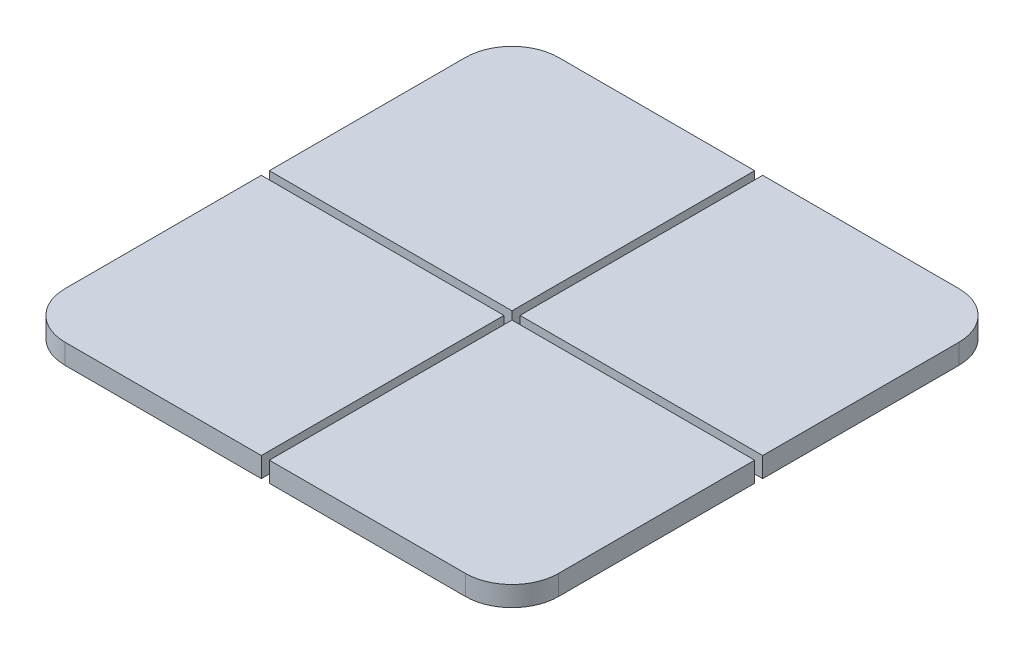
from build123d import *

# Parameters (mm, degrees)
BOSS_EXTRUDE1_DEPTH   = 1.27
BOSS_EXTRUDE1_2_DEPTH = 1.27
BOSS_EXTRUDE1_3_DEPTH = 1.27
BOSS_EXTRUDE1_4_DEPTH = 1.27


with BuildPart() as part:
    # Sketch1 → Boss-Extrude1 (new body)
    with BuildSketch(Plane(origin=(0, 0, 0), x_dir=(1, 0, 0), z_dir=(0, 1, 0))):
        with BuildLine():
            Line((-0.254, 15.621), (-12.6746, 15.621))
            ThreePointArc((-12.6746, 15.621), (-14.75801942, 14.75801942), (-15.621, 12.6746))
            Line((-15.621, 12.6746), (-15.621, 0.254))
            Line((-15.621, 0.254), (-0.254, 0.254))
            Line((-0.254, 0.254), (-0.254, 15.621))
        make_face()
    extrude(amount=-BOSS_EXTRUDE1_DEPTH)


with BuildPart() as body_2:
    # Sketch1 → Boss-Extrude1 2 (new body)
    with BuildSketch(Plane(origin=(0, 0, 0), x_dir=(1, 0, 0), z_dir=(0, 1, 0))):
        with BuildLine():
            Line((12.6746, 15.621), (0.254, 15.621))
            Line((0.254, 15.621), (0.254, 0.254))
            Line((0.254, 0.254), (15.621, 0.254))
            Line((15.621, 0.254), (15.621, 12.6746))
            ThreePointArc((15.621, 12.6746), (14.75801942, 14.75801942), (12.6746, 15.621))
        make_face()
    extrude(amount=-BOSS_EXTRUDE1_2_DEPTH)


with BuildPart() as body_3:
    # Sketch1 → Boss-Extrude1 3 (new body)
    with BuildSketch(Plane(origin=(0, 0, 0), x_dir=(1, 0, 0), z_dir=(0, 1, 0))):
        with BuildLine():
            Line((-0.254, -15.621), (-0.254, -0.254))
            Line((-0.254, -0.254), (-15.621, -0.254))
            Line((-15.621, -0.254), (-15.621, -12.6746))
            ThreePointArc((-15.621, -12.6746), (-14.75801942, -14.75801942), (-12.6746, -15.621))
            Line((-12.6746, -15.621), (-0.254, -15.621))
        make_face()
    extrude(amount=-BOSS_EXTRUDE1_3_DEPTH)


with BuildPart() as body_4:
    # Sketch1 → Boss-Extrude1 4 (new body)
    with BuildSketch(Plane(origin=(0, 0, 0), x_dir=(1, 0, 0), z_dir=(0, 1, 0))):
        with BuildLine():
            Line((15.621, -0.254), (0.254, -0.254))
            Line((0.254, -0.254), (0.254, -15.621))
            Line((0.254, -15.621), (12.6746, -15.621))
            ThreePointArc((12.6746, -15.621), (14.75801942, -14.75801942), (15.621, -12.6746))
            Line((15.621, -12.6746), (15.621, -0.254))
        make_face()
    extrude(amount=-BOSS_EXTRUDE1_4_DEPTH)


solid = Compound([part.part, body_2.part, body_3.part, body_4.part])
